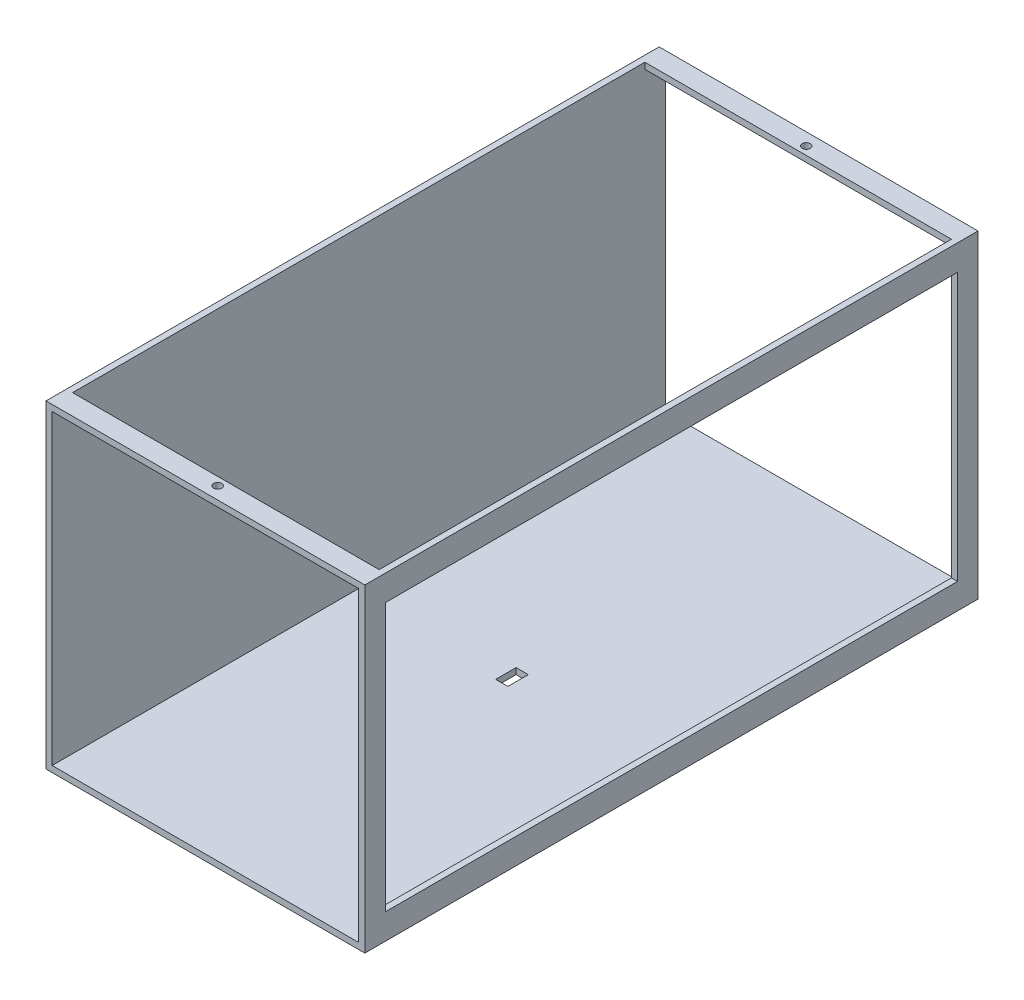
from build123d import *

# Parameters (mm, degrees)
SKETCH1_W           = 156
SKETCH1_H           = 156
SKETCH1_W_2         = 150
SKETCH1_H_2         = 150
EXTRUDE_THIN1_DEPTH = 300
SKETCH2_W           = 280
SKETCH2_H           = 131
CUT_EXTRUDE1_DEPTH  = 10
SKETCH3_W           = 150
SKETCH3_H           = 300
CUT_EXTRUDE2_DEPTH  = 10
SKETCH7_W           = 10
SKETCH7_H           = 12.5
BOSS_EXTRUDE1_DEPTH = 150
SKETCH8_W           = 10
SKETCH8_H           = 12.5
BOSS_EXTRUDE2_DEPTH = 150
SKETCH10_R          = 2
CUT_EXTRUDE5_DEPTH  = 10
SKETCH10_3_R        = 2
CUT_EXTRUDE6_DEPTH  = 10
SKETCH11_W          = 6
SKETCH11_H          = 10
CUT_EXTRUDE7_DEPTH  = 10
SKETCH12_W          = 150
SKETCH12_H          = 9.5
CUT_EXTRUDE8_DEPTH  = 343


with BuildPart() as part:
    # Sketch1 → Extrude-Thin1 (new body)
    with BuildSketch(Plane.XY):
        Rectangle(SKETCH1_W, SKETCH1_H)
        Rectangle(SKETCH1_W_2, SKETCH1_H_2, mode=Mode.SUBTRACT)
    extrude(amount=EXTRUDE_THIN1_DEPTH)

    # Sketch2 → Cut-Extrude1 (cut)
    with BuildSketch(Plane(origin=(78, 0, 0), x_dir=(0, 0, -1), z_dir=(1, 0, 0))):
        with Locations((-150, 0)):
            Rectangle(SKETCH2_W, SKETCH2_H)
    extrude(amount=-CUT_EXTRUDE1_DEPTH, mode=Mode.SUBTRACT)

    # Sketch3 → Cut-Extrude2 (cut)
    with BuildSketch(Plane(origin=(0, 78, 0), x_dir=(1, 0, 0), z_dir=(0, 1, 0))):
        with Locations((0, -150)):
            Rectangle(SKETCH3_W, SKETCH3_H)
    extrude(amount=-CUT_EXTRUDE2_DEPTH, mode=Mode.SUBTRACT)

    # Sketch7 → Boss-Extrude1 (add)
    with BuildSketch(Plane(origin=(-75, 0, 0), x_dir=(0, 0, -1), z_dir=(1, 0, 0))):
        with Locations((-295, 71.75)):
            Rectangle(SKETCH7_W, SKETCH7_H)
    extrude(amount=BOSS_EXTRUDE1_DEPTH)

    # Sketch8 → Boss-Extrude2 (add)
    with BuildSketch(Plane(origin=(-75, 0, 0), x_dir=(0, 0, -1), z_dir=(1, 0, 0))):
        with Locations((-5, 71.75)):
            Rectangle(SKETCH8_W, SKETCH8_H)
    extrude(amount=BOSS_EXTRUDE2_DEPTH)

    # Sketch10 → Cut-Extrude5 (cut)
    with BuildSketch(Plane(origin=(0, 78, 0), x_dir=(1, 0, 0), z_dir=(0, 1, 0))):
        with Locations((0, -6)):
            Circle(SKETCH10_R)
    extrude(amount=-CUT_EXTRUDE5_DEPTH, mode=Mode.SUBTRACT)

    # Sketch10<3> → Cut-Extrude6 (cut)
    with BuildSketch(Plane(origin=(0, 78, 0), x_dir=(1, 0, 0), z_dir=(0, 1, 0))):
        with Locations((0, -294)):
            Circle(SKETCH10_3_R)
    extrude(amount=-CUT_EXTRUDE6_DEPTH, mode=Mode.SUBTRACT)

    # Sketch11 → Cut-Extrude7 (cut)
    with BuildSketch(Plane.XZ.offset(78)):
        with Locations((0, 150)):
            Rectangle(SKETCH11_W, SKETCH11_H)
    extrude(amount=-CUT_EXTRUDE7_DEPTH, mode=Mode.SUBTRACT)

    # Sketch12 → Cut-Extrude8 (cut)
    with BuildSketch(Plane.XY.offset(300)):
        with Locations((0, 70.25)):
            Rectangle(SKETCH12_W, SKETCH12_H)
    extrude(amount=-CUT_EXTRUDE8_DEPTH, mode=Mode.SUBTRACT)


solid = part.part
